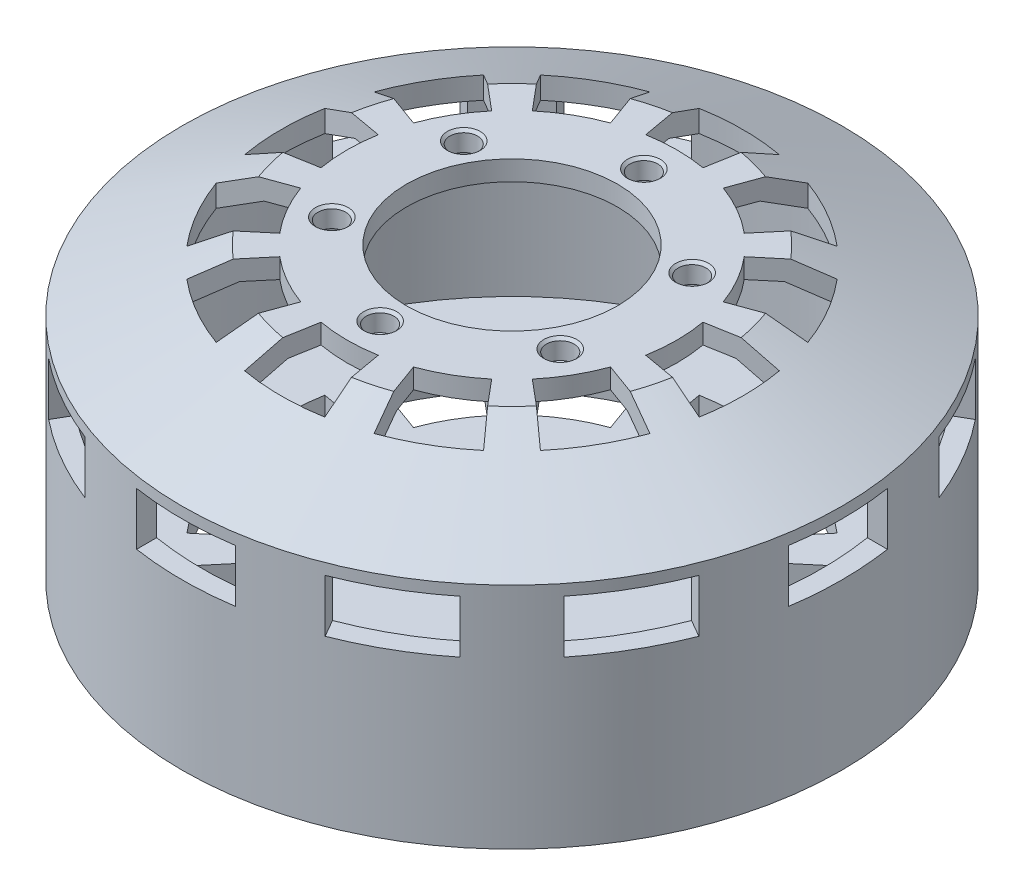
from build123d import *
from build123d.topology import SkipClean

# Parameters (mm, degrees)
SKETCH_1_R                  = 50
EXTRUDE_1_DEPTH             = 4
HOLE_WIZARD_M43_D           = 4.2
HOLE_WIZARD_M43_CSINK_D     = 5
HOLE_WIZARD_M43_CSINK_ANGLE = 90
CUT_EXTRUDE_1_DEPTH         = 84.282651255
SKETCH_11_W                 = 15
SKETCH_11_H                 = 8
CUT_EXTRUDE_2_DEPTH         = 84.282651428
PATTERN_CIRCULAR_1_COUNT    = 12
HOLE_WIZARD_M44_D           = 4.2
HOLE_WIZARD_M44_DEPTH       = 3
HOLE_WIZARD_M44_CSINK_D     = 5
HOLE_WIZARD_M44_CSINK_ANGLE = 90


with BuildPart() as part:
    # Эскиз1 → Бобышка-Вытянуть1 (new body)
    with BuildSketch(Plane(origin=(0, 0, 0), x_dir=(1, 0, 0), z_dir=(0, 1, 0))):
        with Locations(Location((0, 0, 0), (0, 0, 270))):
            Circle(SKETCH_1_R)
    extrude(amount=EXTRUDE_1_DEPTH)

    # Сверло под метчик  спиральное M43 (through all)
    with Locations(Plane(origin=(0, 0, 0), x_dir=(-1, 0, 0), z_dir=(0, -1, 0))):
        with Locations((-21.25, 36.806079661), (0, 42.5), (21.25, 36.806079661), (36.806079661, 21.25), (42.5, 0), (36.806079661, -21.25), (21.25, -36.806079661), (0, -42.5), (-21.25, -36.806079661), (-36.806079661, -21.25), (-42.5, 0), (-36.806079661, 21.25)):
            CounterSinkHole(HOLE_WIZARD_M43_D / 2, HOLE_WIZARD_M43_CSINK_D / 2, counter_sink_angle=HOLE_WIZARD_M43_CSINK_ANGLE)

    # Эскиз7 → Повернуть1 (revolve)
    with BuildSketch(Plane.XY):
        Polygon((47, 32.762636054), (47, 4), (50, 4), (50, 34.673846837), (30, 44), (16, 44), (16, 41), (29.334916012, 41), align=None)
    revolve(axis=Axis((0, -1000, 0), (0, 1, 0)))

    # Эскиз4 → Вырез-Вытянуть1 (cut, through all)
    with SkipClean():  # the faces are left unmerged after this step: merging them gives an invalid solid
        with BuildSketch(Plane.XZ):
            with BuildLine():
                Line((-6.077686218, 34.468271355), (-4.341204442, 24.620193825))
                ThreePointArc((-4.341204442, 24.620193825), (0, 25), (4.341204442, 24.620193825))
                Line((4.341204442, 24.620193825), (6.077686218, 34.468271355))
                ThreePointArc((6.077686218, 34.468271355), (0, 35), (-6.077686218, 34.468271355))
            make_face()
            with BuildLine():
                Line((11.970705016, 32.889241728), (8.550503583, 23.49231552))
                ThreePointArc((8.550503583, 23.49231552), (12.5, 21.650635095), (16.069690242, 19.151111078))
                Line((16.069690242, 19.151111078), (22.497566339, 26.811555509))
                ThreePointArc((22.497566339, 26.811555509), (17.5, 30.310889132), (11.970705016, 32.889241728))
            make_face()
            with BuildLine():
                Line((26.811555509, 22.497566339), (19.151111078, 16.069690242))
                ThreePointArc((19.151111078, 16.069690242), (21.650635095, 12.5), (23.49231552, 8.550503583))
                Line((23.49231552, 8.550503583), (32.889241728, 11.970705016))
                ThreePointArc((32.889241728, 11.970705016), (30.310889132, 17.5), (26.811555509, 22.497566339))
            make_face()
            with BuildLine():
                Line((34.468271355, 6.077686218), (24.620193825, 4.341204442))
                ThreePointArc((24.620193825, 4.341204442), (25, 0), (24.620193825, -4.341204442))
                Line((24.620193825, -4.341204442), (34.468271355, -6.077686218))
                ThreePointArc((34.468271355, -6.077686218), (35, 0), (34.468271355, 6.077686218))
            make_face()
            with BuildLine():
                Line((32.889241728, -11.970705016), (23.49231552, -8.550503583))
                ThreePointArc((23.49231552, -8.550503583), (21.650635095, -12.5), (19.151111078, -16.069690242))
                Line((19.151111078, -16.069690242), (26.811555509, -22.497566339))
                ThreePointArc((26.811555509, -22.497566339), (30.310889132, -17.5), (32.889241728, -11.970705016))
            make_face()
            with BuildLine():
                Line((22.497566339, -26.811555509), (16.069690242, -19.151111078))
                ThreePointArc((16.069690242, -19.151111078), (12.5, -21.650635095), (8.550503583, -23.49231552))
                Line((8.550503583, -23.49231552), (11.970705016, -32.889241728))
                ThreePointArc((11.970705016, -32.889241728), (17.5, -30.310889132), (22.497566339, -26.811555509))
            make_face()
            with BuildLine():
                Line((6.077686218, -34.468271355), (4.341204442, -24.620193825))
                ThreePointArc((4.341204442, -24.620193825), (0, -25), (-4.341204442, -24.620193825))
                Line((-4.341204442, -24.620193825), (-6.077686218, -34.468271355))
                ThreePointArc((-6.077686218, -34.468271355), (0, -35), (6.077686218, -34.468271355))
            make_face()
            with BuildLine():
                Line((-11.970705016, -32.889241728), (-8.550503583, -23.49231552))
                ThreePointArc((-8.550503583, -23.49231552), (-12.5, -21.650635095), (-16.069690242, -19.151111078))
                Line((-16.069690242, -19.151111078), (-22.497566339, -26.811555509))
                ThreePointArc((-22.497566339, -26.811555509), (-17.5, -30.310889132), (-11.970705016, -32.889241728))
            make_face()
            with BuildLine():
                Line((-26.811555509, -22.497566339), (-19.151111078, -16.069690242))
                ThreePointArc((-19.151111078, -16.069690242), (-21.650635095, -12.5), (-23.49231552, -8.550503583))
                Line((-23.49231552, -8.550503583), (-32.889241728, -11.970705016))
                ThreePointArc((-32.889241728, -11.970705016), (-30.310889132, -17.5), (-26.811555509, -22.497566339))
            make_face()
            with BuildLine():
                Line((-34.468271355, -6.077686218), (-24.620193825, -4.341204442))
                ThreePointArc((-24.620193825, -4.341204442), (-25, 0), (-24.620193825, 4.341204442))
                Line((-24.620193825, 4.341204442), (-34.468271355, 6.077686218))
                ThreePointArc((-34.468271355, 6.077686218), (-35, 0), (-34.468271355, -6.077686218))
            make_face()
            with BuildLine():
                Line((-32.889241728, 11.970705016), (-23.49231552, 8.550503583))
                ThreePointArc((-23.49231552, 8.550503583), (-21.650635095, 12.5), (-19.151111078, 16.069690242))
                Line((-19.151111078, 16.069690242), (-26.811555509, 22.497566339))
                ThreePointArc((-26.811555509, 22.497566339), (-30.310889132, 17.5), (-32.889241728, 11.970705016))
            make_face()
            with BuildLine():
                Line((-22.497566339, 26.811555509), (-16.069690242, 19.151111078))
                ThreePointArc((-16.069690242, 19.151111078), (-12.5, 21.650635095), (-8.550503583, 23.49231552))
                Line((-8.550503583, 23.49231552), (-11.970705016, 32.889241728))
                ThreePointArc((-11.970705016, 32.889241728), (-17.5, 30.310889132), (-22.497566339, 26.811555509))
            make_face()
        extrude(amount=-CUT_EXTRUDE_1_DEPTH, mode=Mode.SUBTRACT)
    add(part.part.scale(1), mode=Mode.REPLACE)  # the faces are merged on a copy

    # Эскиз11 → Вырез-Вытянуть2 (cut, through all)
    with BuildSketch(Plane(origin=(0, 0, 0), x_dir=(0, 0, -1), z_dir=(1, 0, 0))):
        with Locations((0, 29)):
            Rectangle(SKETCH_11_W, SKETCH_11_H)
    cut_extrude_2 = extrude(amount=-CUT_EXTRUDE_2_DEPTH, mode=Mode.SUBTRACT)

    # Круговой массив1: Вырез-Вытянуть2 ×12 about axis
    pattern_circular_1_axis = Axis((0, 0, 0), (0, 1, 0))
    for i in range(1, PATTERN_CIRCULAR_1_COUNT):
        add(cut_extrude_2.rotate(pattern_circular_1_axis, i * 360 / PATTERN_CIRCULAR_1_COUNT), mode=Mode.SUBTRACT)

    # Сверло под метчик  спиральное M44
    with Locations(Plane(origin=(0, 44, 0), x_dir=(1, 0, 0), z_dir=(0, 1, 0))):
        with Locations((-17.320508076, 10), (0, 20), (17.320508076, 10), (17.320508076, -10), (0, -20), (-17.320508076, -10)):
            CounterSinkHole(HOLE_WIZARD_M44_D / 2, HOLE_WIZARD_M44_CSINK_D / 2, depth=HOLE_WIZARD_M44_DEPTH, counter_sink_angle=HOLE_WIZARD_M44_CSINK_ANGLE)


solid = part.part
